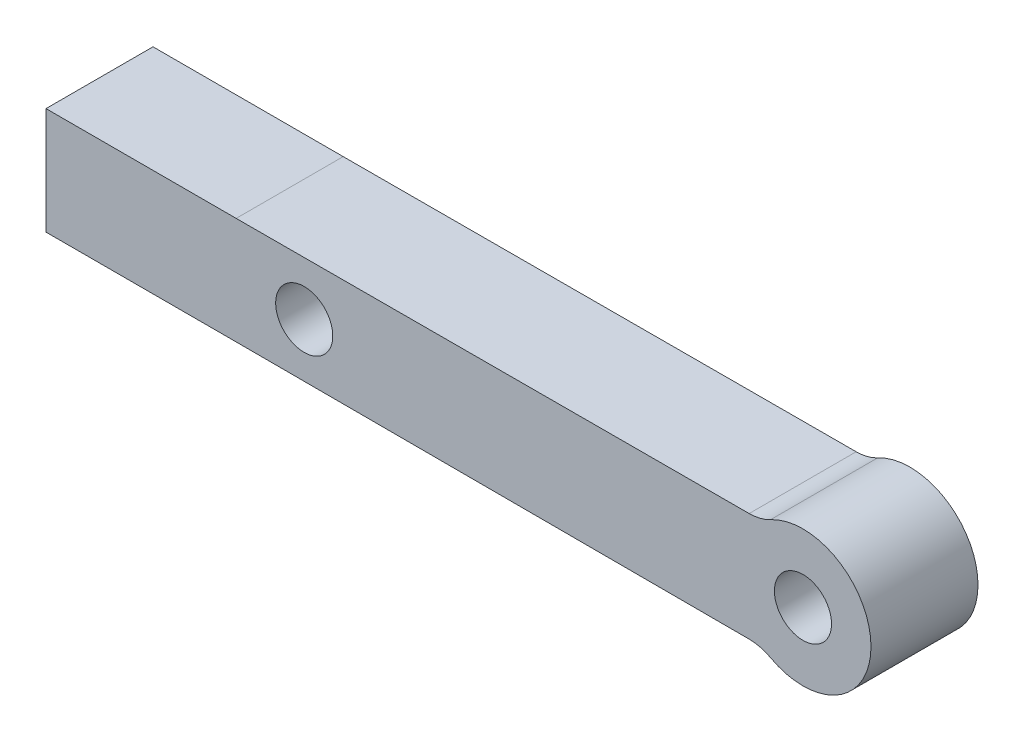
from build123d import *

# Parameters (mm, degrees)
SKETCH1_R           = 1.6
BOSS_EXTRUDE1_DEPTH = 5.9944


with BuildPart() as part:
    # Sketch1 → Boss-Extrude1 (new body)
    with BuildSketch(Plane.XY):
        with BuildLine():
            Line((-31.75, 2.9972), (-37.7444, 2.9972))
            Line((-37.7444, 2.9972), (-42.403721744, 2.9972))
            Line((-42.403721744, 2.9972), (-42.403721744, -2.9972))
            Line((-42.403721744, -2.9972), (-37.7444, -2.9972))
            Line((-37.7444, -2.9972), (-31.75, -2.9972))
            Line((-31.75, -2.9972), (-3.01403503, -3.046744767))
            ThreePointArc((-3.01403503, -3.046744767), (-2.393607559, -3.124787196), (-1.8110486, -3.352044595))
            ThreePointArc((-1.8110486, -3.352044595), (3.81, 0), (-1.8110486, 3.352044595))
            ThreePointArc((-1.8110486, 3.352044595), (-2.393607559, 3.124787196), (-3.01403503, 3.046744767))
            Line((-3.01403503, 3.046744767), (-31.75, 2.9972))
        make_face()
        Circle(SKETCH1_R, mode=Mode.SUBTRACT)
        with Locations((-27.94, 0)):
            Circle(SKETCH1_R, mode=Mode.SUBTRACT)
    extrude(amount=BOSS_EXTRUDE1_DEPTH)


solid = part.part
